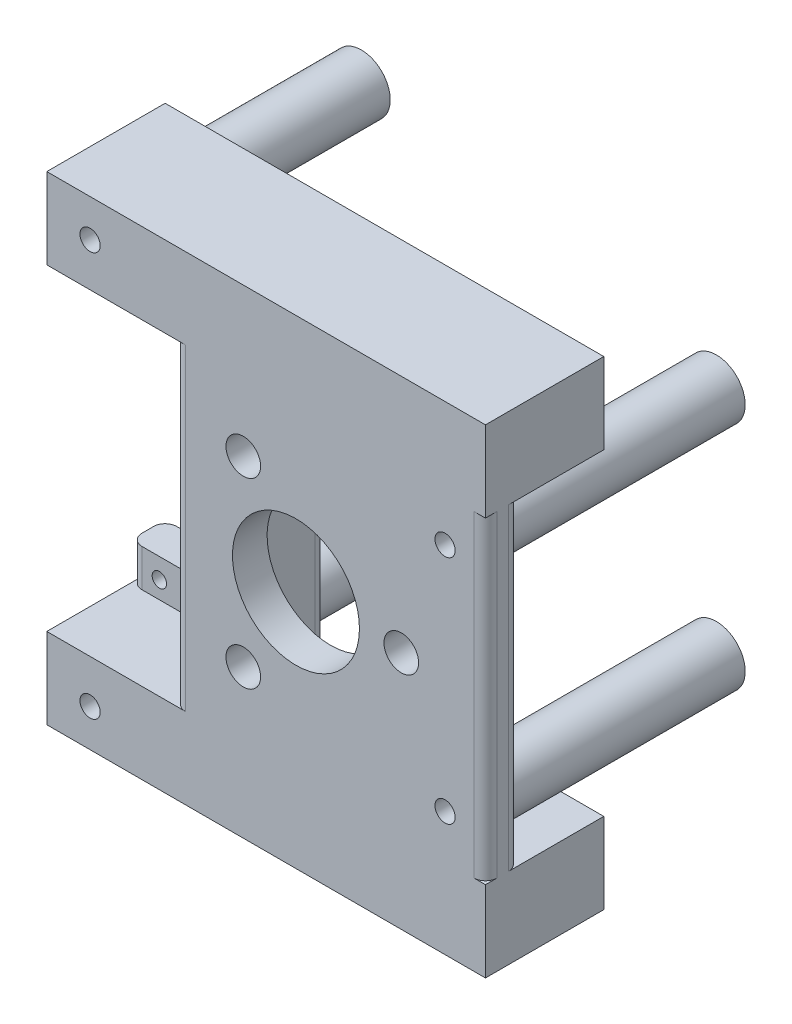
from build123d import *

# Parameters (mm, degrees)
SKETCH1_W               = 28
SKETCH1_H               = 55
SKETCH1_R               = 1.25
BOSS_EXTRUDE1_DEPTH     = 6
SKETCH2_W               = 6
SKETCH2_H               = 55
BOSS_EXTRUDE2_DEPTH     = 14.5
SKETCH3_W               = 6
SKETCH3_H               = 55
BOSS_EXTRUDE3_DEPTH     = 48
SKETCH4_R               = 3
SKETCH4_R_2             = 11
CUT_EXTRUDE1_DEPTH      = 48
FILLET4_R               = 2
SKETCH5_W               = 21
SKETCH5_H               = 42
CUT_EXTRUDE2_DEPTH      = 10
FILLET5_R               = 2
ESQUISSE2_R             = 5
BOSS_EXTRU_3_DEPTH      = 41
ESQUISSE3_R             = 1.75
ENL_V_MAT_EXTRU_1_DEPTH = 105.928547117
ESQUISSE4_W             = 76
ESQUISSE4_H             = 20.5
BOSS_EXTRU_4_DEPTH      = 14
ESQUISSE5_W             = 76
ESQUISSE5_H             = 20.5
BOSS_EXTRU_5_DEPTH      = 14
ESQUISSE7_R             = 5
BOSS_EXTRU_8_DEPTH      = 26.5
ESQUISSE10_R            = 1.75
ENL_V_MAT_EXTRU_2_DEPTH = 113.898184219
ENL_V_MAT_EXTRU_3_DEPTH = 4.1
ENL_V_MAT_EXTRU_4_DEPTH = 4.1


with BuildPart() as part:
    # Sketch1 → Boss-Extrude1 (new body)
    with BuildSketch(Plane.XY):
        with Locations((14, 27.5)):
            Rectangle(SKETCH1_W, SKETCH1_H)
        with Locations((5, 52)):
            Circle(SKETCH1_R, mode=Mode.SUBTRACT)
        with Locations((15, 52)):
            Circle(SKETCH1_R, mode=Mode.SUBTRACT)
        with Locations((5, 3)):
            Circle(SKETCH1_R, mode=Mode.SUBTRACT)
        with Locations((15, 3)):
            Circle(SKETCH1_R, mode=Mode.SUBTRACT)
    extrude(amount=BOSS_EXTRUDE1_DEPTH)

    # Sketch2 → Boss-Extrude2 (add)
    with BuildSketch(Plane.XY.offset(6)):
        with Locations((25, 27.5)):
            Rectangle(SKETCH2_W, SKETCH2_H)
    extrude(amount=BOSS_EXTRUDE2_DEPTH)

    # Sketch3 → Boss-Extrude3 (add)
    with BuildSketch(Plane(origin=(28, 0, 0), x_dir=(0, 0, -1), z_dir=(1, 0, 0))):
        with Locations((-17.5, 27.5)):
            Rectangle(SKETCH3_W, SKETCH3_H)
    extrude(amount=BOSS_EXTRUDE3_DEPTH)

    # Sketch4 → Cut-Extrude1 (cut)
    with BuildSketch(Plane.XY.offset(20.5)):
        with Locations((61.416247904, 27.5)):
            Circle(SKETCH4_R)
        with Locations((34.041247904, 11.695036381)):
            Circle(SKETCH4_R)
        with Locations((34.041247904, 43.304963619)):
            Circle(SKETCH4_R)
        with Locations((43.166247904, 27.5)):
            Circle(SKETCH4_R_2)
    extrude(amount=-CUT_EXTRUDE1_DEPTH, mode=Mode.SUBTRACT)

    # Fillet4
    fillet4_edges = [part.edges().sort_by_distance(p)[0] for p in [
        (22, 27.5, 20.5),
        (0, 27.5, 6),
        (0, 27.5, 0),
        (76, 27.5, 14.5),
        (28, 27.5, 14.5),
        (28, 27.5, 0),
        (76, 27.5, 20.5),
    ]]
    fillet(fillet4_edges, radius=FILLET4_R)

    # Sketch5 → Cut-Extrude2 (cut)
    with BuildSketch(Plane.XY.offset(6)):
        with Locations((10.5, 27.5)):
            Rectangle(SKETCH5_W, SKETCH5_H)
    extrude(amount=-CUT_EXTRUDE2_DEPTH, mode=Mode.SUBTRACT)

    # Fillet5
    # the kernel refuses this fillet: 2 mm, written as the material it adds along each edge
    with BuildSketch(Plane(origin=(22, 55, 6), x_dir=(-1, 0, 0), z_dir=(0, -1, 0))) as fillet5_piece_1_section:
        with BuildLine():
            CenterArc((FILLET5_R, -FILLET5_R), FILLET5_R, 90, 90)
            Line((0, -FILLET5_R), (0, 0))
            Line((0, 0), (FILLET5_R, 0))
        make_face()
    fillet5_piece_1 = extrude(amount=55, mode=Mode.PRIVATE)
    fillet5_piece_1 = split(fillet5_piece_1, bisect_by=Plane(origin=(21, 51.75, 6.048016763), z_dir=(-1, 0, 0)), keep=Keep.TOP, mode=Mode.PRIVATE)
    fillet5_piece_1 = split(fillet5_piece_1, bisect_by=Plane(origin=(20.673498431, 48.5, 6.048016763), z_dir=(0, 1, 0)), keep=Keep.TOP, mode=Mode.PRIVATE)
    add(fillet5_piece_1)
    with BuildSketch(Plane(origin=(22, 55, 6), x_dir=(-1, 0, 0), z_dir=(0, -1, 0))) as fillet5_piece_2_section:
        with BuildLine():
            CenterArc((FILLET5_R, -FILLET5_R), FILLET5_R, 90, 90)
            Line((0, -FILLET5_R), (0, 0))
            Line((0, 0), (FILLET5_R, 0))
        make_face()
    fillet5_piece_2 = extrude(amount=55, mode=Mode.PRIVATE)
    fillet5_piece_2 = split(fillet5_piece_2, bisect_by=Plane(origin=(21, 51.75, 6.51024012), z_dir=(1, 0, 0)), keep=Keep.TOP, mode=Mode.PRIVATE)
    fillet5_piece_2 = split(fillet5_piece_2, bisect_by=Plane(origin=(21.671216471, 48.5, 6.51024012), z_dir=(0, 1, 0)), keep=Keep.TOP, mode=Mode.PRIVATE)
    add(fillet5_piece_2)
    with BuildSketch(Plane(origin=(22, 55, 6), x_dir=(-1, 0, 0), z_dir=(0, -1, 0))) as fillet5_piece_3_section:
        with BuildLine():
            CenterArc((FILLET5_R, -FILLET5_R), FILLET5_R, 90, 90)
            Line((0, -FILLET5_R), (0, 0))
            Line((0, 0), (FILLET5_R, 0))
        make_face()
    fillet5_piece_3 = extrude(amount=55, mode=Mode.PRIVATE)
    fillet5_piece_3 = split(fillet5_piece_3, bisect_by=Plane(origin=(21.671216471, 6.5, 6.51024012), z_dir=(0, 1, 0)), keep=Keep.TOP, mode=Mode.PRIVATE)
    fillet5_piece_3 = split(fillet5_piece_3, bisect_by=Plane(origin=(21, 27.5, 6.51024012), z_dir=(1, 0, 0)), keep=Keep.TOP, mode=Mode.PRIVATE)
    fillet5_piece_3 = split(fillet5_piece_3, bisect_by=Plane(origin=(21.671216471, 48.5, 6.51024012), z_dir=(0, -1, 0)), keep=Keep.TOP, mode=Mode.PRIVATE)
    add(fillet5_piece_3)
    with BuildSketch(Plane(origin=(22, 55, 6), x_dir=(-1, 0, 0), z_dir=(0, -1, 0))) as fillet5_piece_4_section:
        with BuildLine():
            CenterArc((FILLET5_R, -FILLET5_R), FILLET5_R, 90, 90)
            Line((0, -FILLET5_R), (0, 0))
            Line((0, 0), (FILLET5_R, 0))
        make_face()
    fillet5_piece_4 = extrude(amount=55, mode=Mode.PRIVATE)
    fillet5_piece_4 = split(fillet5_piece_4, bisect_by=Plane(origin=(20.673498431, 6.5, 6.048016763), z_dir=(0, -1, 0)), keep=Keep.TOP, mode=Mode.PRIVATE)
    fillet5_piece_4 = split(fillet5_piece_4, bisect_by=Plane(origin=(21, 3.25, 6.048016763), z_dir=(-1, 0, 0)), keep=Keep.TOP, mode=Mode.PRIVATE)
    add(fillet5_piece_4)
    with BuildSketch(Plane(origin=(22, 55, 6), x_dir=(-1, 0, 0), z_dir=(0, -1, 0))) as fillet5_piece_5_section:
        with BuildLine():
            CenterArc((FILLET5_R, -FILLET5_R), FILLET5_R, 90, 90)
            Line((0, -FILLET5_R), (0, 0))
            Line((0, 0), (FILLET5_R, 0))
        make_face()
    fillet5_piece_5 = extrude(amount=55, mode=Mode.PRIVATE)
    fillet5_piece_5 = split(fillet5_piece_5, bisect_by=Plane(origin=(21.671216471, 6.5, 6.51024012), z_dir=(0, -1, 0)), keep=Keep.TOP, mode=Mode.PRIVATE)
    fillet5_piece_5 = split(fillet5_piece_5, bisect_by=Plane(origin=(21, 3.25, 6.51024012), z_dir=(1, 0, 0)), keep=Keep.TOP, mode=Mode.PRIVATE)
    add(fillet5_piece_5)

    # Esquisse2 → Boss.-Extru.3 (add)
    with BuildSketch(Plane(origin=(0, 0, 14.5), x_dir=(-1, 0, 0), z_dir=(0, 0, -1))):
        with Locations(Location((-69, 47.5, 0), (0, 0, 180))):
            Circle(ESQUISSE2_R)
        with Locations(Location((-69, 7.5, 0), (0, 0, 180))):
            Circle(ESQUISSE2_R)
    extrude(amount=BOSS_EXTRU_3_DEPTH)

    # Esquisse3 → Enlèv. mat.-Extru.1 (cut, through all)
    with BuildSketch(Plane(origin=(0, 0, -26.5), x_dir=(-1, 0, 0), z_dir=(0, 0, -1))):
        with Locations(Location((-69, 7.5, 0), (0, 0, 90))):
            Circle(ESQUISSE3_R)
        with Locations(Location((-69, 47.5, 0), (0, 0, 90))):
            Circle(ESQUISSE3_R)
    extrude(amount=-ENL_V_MAT_EXTRU_1_DEPTH, mode=Mode.SUBTRACT)

    # Esquisse4 → Boss.-Extru.4 (add)
    with BuildSketch(Plane(origin=(0, 55, 0), x_dir=(1, 0, 0), z_dir=(0, 1, 0))):
        with Locations((38, -10.25)):
            Rectangle(ESQUISSE4_W, ESQUISSE4_H)
    extrude(amount=BOSS_EXTRU_4_DEPTH)

    # Esquisse5 → Boss.-Extru.5 (add)
    with BuildSketch(Plane.XZ):
        with Locations((38, 10.25)):
            Rectangle(ESQUISSE5_W, ESQUISSE5_H)
    extrude(amount=BOSS_EXTRU_5_DEPTH)

    # Esquisse7 → Boss.-Extru.8 (add)
    with BuildSketch(Plane(origin=(0, 0, 0), x_dir=(-1, 0, 0), z_dir=(0, 0, -1))):
        with Locations((-7.5, -7.5)):
            Circle(ESQUISSE7_R)
        with Locations((-7.5, 62.5)):
            Circle(ESQUISSE7_R)
    extrude(amount=BOSS_EXTRU_8_DEPTH)

    # Esquisse10 → Enlèv. mat.-Extru.2 (cut, through all)
    with BuildSketch(Plane(origin=(0, 0, -26.5), x_dir=(-1, 0, 0), z_dir=(0, 0, -1))):
        with Locations((-7.5, 62.5)):
            Circle(ESQUISSE10_R)
        with Locations((-7.5, -7.5)):
            Circle(ESQUISSE10_R)
    extrude(amount=-ENL_V_MAT_EXTRU_2_DEPTH, mode=Mode.SUBTRACT)

    # Esquisse11 → Enlèv. mat.-Extru.3 (cut)
    with BuildSketch(Plane(origin=(0, 0, -26.5), x_dir=(-1, 0, 0), z_dir=(0, 0, -1))):
        Polygon((-9.145448267, -4.65), (-10.790896534, -7.5), (-9.145448267, -10.35), (-5.854551733, -10.35), (-4.209103466, -7.5), (-5.854551733, -4.65), align=None)
    extrude(amount=-ENL_V_MAT_EXTRU_3_DEPTH, mode=Mode.SUBTRACT)

    # Esquisse12 → Enlèv. mat.-Extru.4 (cut)
    with BuildSketch(Plane(origin=(0, 0, -26.5), x_dir=(-1, 0, 0), z_dir=(0, 0, -1))):
        Polygon((-9.145448267, 65.35), (-10.790896534, 62.5), (-9.145448267, 59.65), (-5.854551733, 59.65), (-4.209103466, 62.5), (-5.854551733, 65.35), align=None)
        Polygon((-70.645448267, 50.35), (-72.290896534, 47.5), (-70.645448267, 44.65), (-67.354551733, 44.65), (-65.709103466, 47.5), (-67.354551733, 50.35), align=None)
        Polygon((-70.645448267, 10.35), (-72.290896534, 7.5), (-70.645448267, 4.65), (-67.354551733, 4.65), (-65.709103466, 7.5), (-67.354551733, 10.35), align=None)
    extrude(amount=-ENL_V_MAT_EXTRU_4_DEPTH, mode=Mode.SUBTRACT)


solid = part.part
